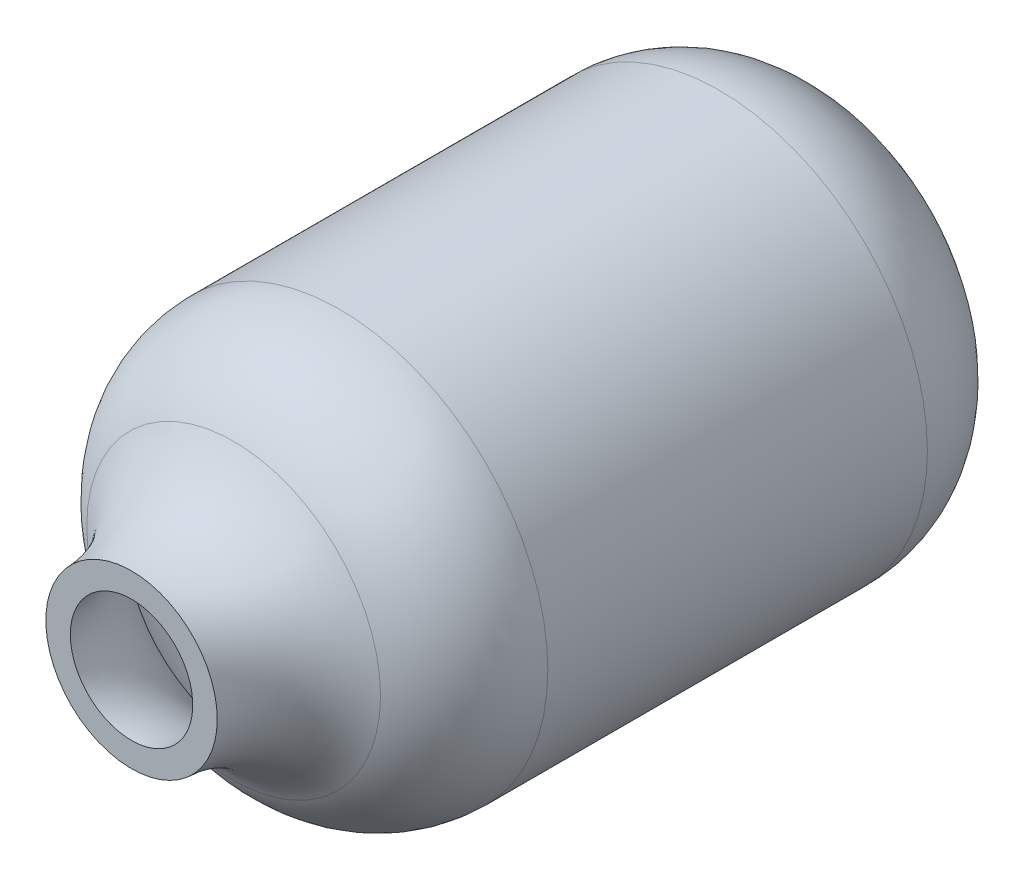
from build123d import *

# Parameters (mm, degrees)
SKETCH1_R           = 17
BOSS_EXTRUDE1_DEPTH = 51
FILLET1_R           = 10
FILLET2_R           = 10
SKETCH2_R           = 7
BOSS_EXTRUDE2_DEPTH = 7
FILLET3_R           = 10
SHELL1_T            = -2


with BuildPart() as part:
    # Sketch1 → Boss-Extrude1 (new body)
    with BuildSketch(Plane.XY):
        Circle(SKETCH1_R)
    extrude(amount=BOSS_EXTRUDE1_DEPTH)

    # Fillet1
    fillet1_edges = [part.edges().sort_by_distance(p)[0] for p in [
        (-17, 0, 0),
    ]]
    fillet(fillet1_edges, radius=FILLET1_R)

    # Fillet2
    fillet2_edges = [part.edges().sort_by_distance(p)[0] for p in [
        (-17, 0, 51),
    ]]
    fillet(fillet2_edges, radius=FILLET2_R)

    # Sketch2 → Boss-Extrude2 (add)
    with BuildSketch(Plane.XY.offset(51)):
        Circle(SKETCH2_R)
    extrude(amount=BOSS_EXTRUDE2_DEPTH)

    # Fillet3
    # the kernel refuses this fillet: 10 mm, written as the material it adds along each edge
    with BuildSketch(Plane(origin=(0, 0, 51), x_dir=(1, 0, 0), z_dir=(0, -1, 0))) as fillet3_piece_1:
        with BuildLine():
            CenterArc((16.994765066, 7.323529412), FILLET3_R, 181.854010516, 58.163304996)
            Line((7, 7), (6.800104699, 6.993529412))
            ThreePointArc((6.800104699, 6.993529412), (6.8, 3.5), (6.8, 0))
            Line((6.8, 0), (7, -0.2))
            ThreePointArc((7, -0.2), (9.534996229, -0.53354374), (11.897434882, -1.511470588))
            Line((11.897434882, -1.511470588), (11.997382533, -1.338235294))
        make_face()
    revolve(axis=Axis((0, 0, 51), (0, 0, 1)))

    # Shell1
    shell1_openings = [part.faces().sort_by_distance(p)[0] for p in [
        (0, 0, 58),
    ]]
    offset(amount=SHELL1_T, openings=shell1_openings, kind=Kind.INTERSECTION)


solid = part.part
